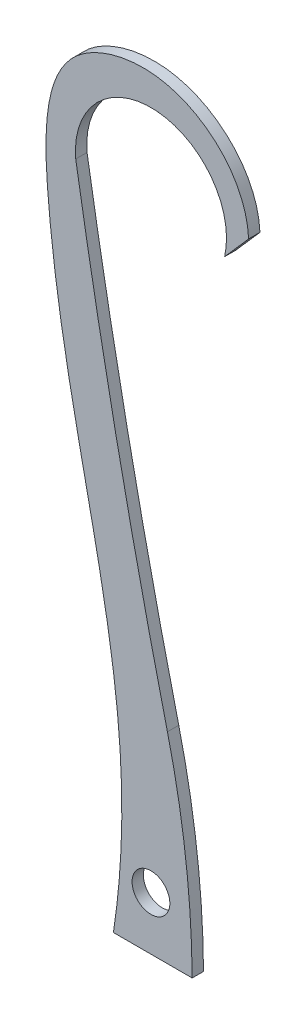
from build123d import *

# Parameters (mm, degrees)
SKETCH2_R           = 12.7
BOSS_EXTRUDE1_DEPTH = 7.62
FILLET1_R           = 589.28


with BuildPart() as part:
    # Sketch2 → Boss-Extrude1 (new body)
    with BuildSketch(Plane.XY):
        with BuildLine():
            Line((-1.274791015, -11.309008578), (14.871495785, 7.100780545))
            add(Edge.make_bspline(
                [(14.871495785, 7.100780545), (13.375290607, 41.311274532), (-33.088786246, 83.552771801), (-124.395877584, 55.918708976), (-118.692404941, -164.860535274), (-53.162998893, -292.737862096), (-76.042100853, -442.292607067)],
                knots=[0, 0, 0, 0, 0.149570106, 0.23103595, 0.376411471, 1, 1, 1, 1], degree=3))
            Line((-76.042100853, -442.292607067), (-23.088177418, -442.292607067))
            Line((-23.088177418, -442.292607067), (-23.088177418, -373.348830577))
            add(Edge.make_bspline(
                [(-101.401950785, -4.481358802), (-70.676914729, -190.640134145), (-23.088177418, -373.348830577)],
                knots=[0, 0, 0, 1, 1, 1], degree=2))
            ThreePointArc((-101.401950785, -4.481358802), (-101.550463544, -2.242866481), (-101.6, 0))
            ThreePointArc((-101.6, 0), (-45.109684386, 50.480296237), (-1.274791015, -11.309008578))
        make_face()
        with Locations((-50.8, -406.4)):
            Circle(SKETCH2_R, mode=Mode.SUBTRACT)
    extrude(amount=BOSS_EXTRUDE1_DEPTH)

    # Fillet1
    # the kernel refuses this fillet: 589.28 mm, written as the material it takes off along each edge
    with BuildSketch(Plane(origin=(-23.088177418, -373.348830577, -172.359441224), x_dir=(-0.24408300348773482, 0.9697543438461137, 0), z_dir=(0, 0, 1))) as fillet1_piece_1:
        with BuildLine():
            CenterArc((73.043211876, 589.260027892), FILLET1_R, 256.266195823, 13.262078021)
            Line((-66.858526732, 16.828004037), (-69.656561504, 5.37936356))
            ThreePointArc((-69.656561504, 5.37936356), (-36.305928012, -3.015134776), (-2.876664646, -11.429136795))
            Line((-2.876664646, -11.429136795), (0.096960278, -11.785201147))
            ThreePointArc((0.096960278, -11.785201147), (34.095828458, -11.645290209), (68.094589766, -11.785200558))
            Line((68.094589766, -11.785200558), (68.191621573, 0))
        make_face()
    extrude(amount=352.338882449, mode=Mode.SUBTRACT)


solid = part.part
